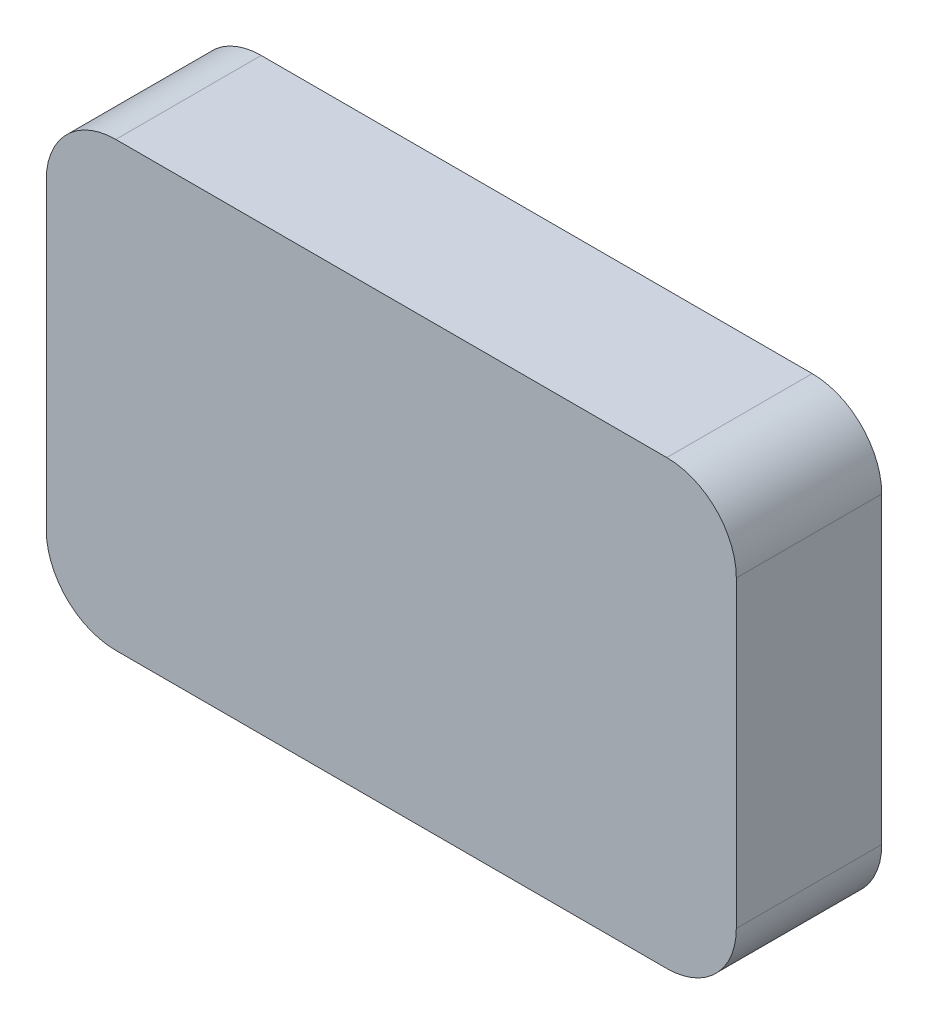
from build123d import *

# Parameters (mm, degrees)
BOSS_EXTRU_1_DEPTH = 3
CONG_1_R           = 2


with BuildPart() as part:
    # Balayage1: sweep along a path in Esquisse1
    with BuildLine(Plane.XY) as balayage1_path:
        Line((-39.634177347, 31.830613733), (39.634177347, 31.830613733))
        ThreePointArc((39.634177347, 31.830613733), (46.705245159, 28.901681545), (49.634177347, 21.830613733))
        Line((49.634177347, 21.830613733), (49.634177347, -21.830613733))
        ThreePointArc((49.634177347, -21.830613733), (46.705245159, -28.901681545), (39.634177347, -31.830613733))
        Line((39.634177347, -31.830613733), (-39.634177347, -31.830613733))
        ThreePointArc((-39.634177347, -31.830613733), (-46.705245159, -28.901681545), (-49.634177347, -21.830613733))
        Line((-49.634177347, -21.830613733), (-49.634177347, 21.830613733))
        ThreePointArc((-49.634177347, 21.830613733), (-46.705245159, 28.901681545), (-39.634177347, 31.830613733))
    # profil → Balayage1 (sweep)
    with BuildSketch(Plane(origin=(0, 0, 0), x_dir=(0, 0, -1), z_dir=(1, 0, 0))):
        with BuildLine():
            Line((0, -30.230613733), (9.122494235, -30.230613733))
            Line((9.122494235, -30.230613733), (17.918249503, -25.630613733))
            Line((17.918249503, -25.630613733), (17.918249503, -27.230613733))
            ThreePointArc((17.918249503, -27.230613733), (16.418249503, -28.730613733), (17.918249503, -30.230613733))
            Line((17.918249503, -30.230613733), (17.918249503, -31.830613733))
            Line((17.918249503, -31.830613733), (0, -31.830613733))
            Line((0, -31.830613733), (0, -30.230613733))
        make_face()
    sweep(path=balayage1_path.line)

    # Esquisse1<3> → Boss.-Extru.1 (add)
    with BuildSketch(Plane.XY):
        with BuildLine():
            Line((-39.634177347, 31.830613733), (39.634177347, 31.830613733))
            ThreePointArc((39.634177347, 31.830613733), (46.705245159, 28.901681545), (49.634177347, 21.830613733))
            Line((49.634177347, 21.830613733), (49.634177347, -21.830613733))
            ThreePointArc((49.634177347, -21.830613733), (46.705245159, -28.901681545), (39.634177347, -31.830613733))
            Line((39.634177347, -31.830613733), (-39.634177347, -31.830613733))
            ThreePointArc((-39.634177347, -31.830613733), (-46.705245159, -28.901681545), (-49.634177347, -21.830613733))
            Line((-49.634177347, -21.830613733), (-49.634177347, 21.830613733))
            ThreePointArc((-49.634177347, 21.830613733), (-46.705245159, 28.901681545), (-39.634177347, 31.830613733))
        make_face()
    extrude(amount=BOSS_EXTRU_1_DEPTH)

    # Congé1
    cong_1_edges = [part.edges().sort_by_distance(p)[0] for p in [
        (-45.573874309, 27.770310695, 0),
        (-48.034177347, 0, 0),
        (-45.573874309, -27.770310695, 0),
        (0, -30.230613733, 0),
        (0, -30.230613733, 0),
        (45.573874309, -27.770310695, 0),
        (48.034177347, 0, 0),
        (45.573874309, 27.770310695, 0),
        (0, 30.230613733, 0),
    ]]
    fillet(cong_1_edges, radius=CONG_1_R)


solid = part.part
